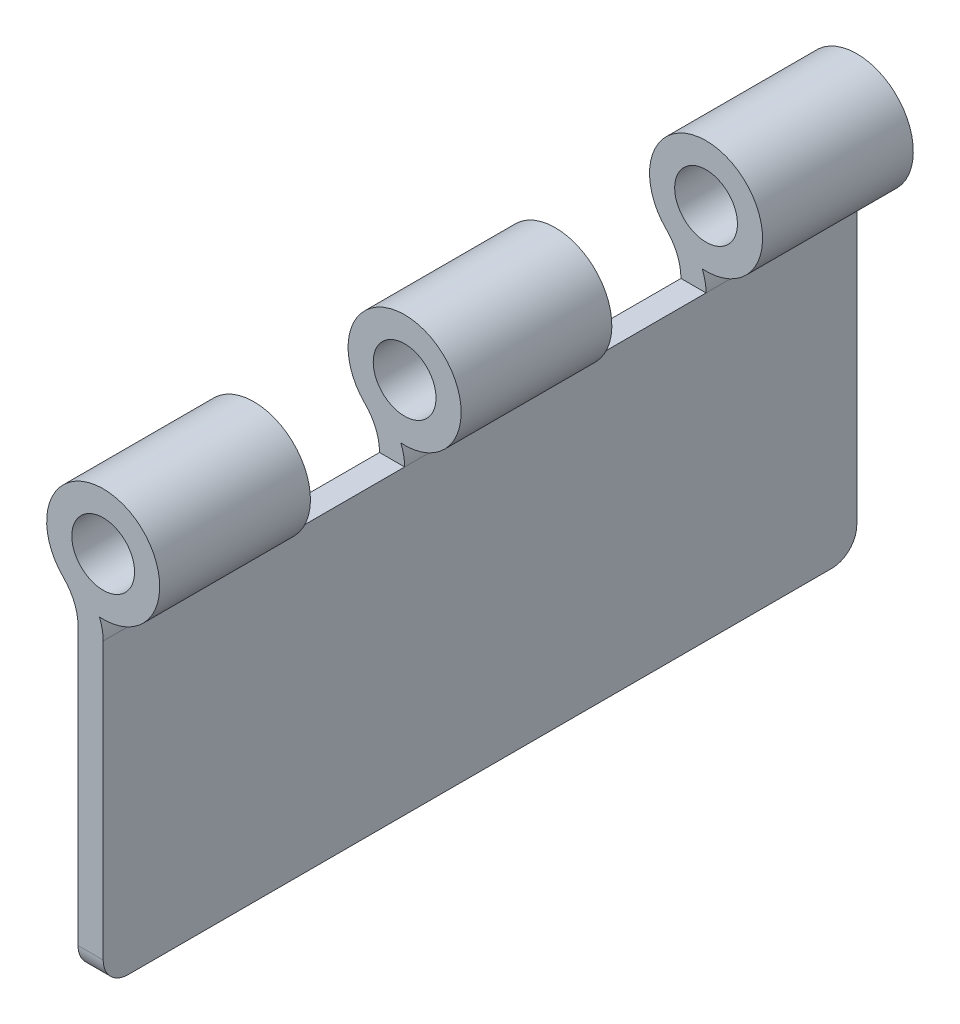
from build123d import *

# Parameters (mm, degrees)
SKETCH1_R           = 3.175
BOSS_EXTRUDE1_DEPTH = 38.1
SKETCH2_R           = 3.175
CUT_EXTRUDE1_DEPTH  = 7.62
FILLET1_R           = 2.54


with BuildPart() as part:
    # Sketch1 → Boss-Extrude1 (new, symmetric)
    with BuildSketch(Plane.XY):
        with BuildLine():
            Line((-2.54, 0), (0, 0))
            Line((0, 0), (0, 30.48))
            ThreePointArc((0, 30.48), (-0.096177955, 31.457600747), (-0.381023909, 32.39771574))
            ThreePointArc((-0.381023909, 32.39771574), (2.351034724, 43.309017251), (-4.024171598, 34.042011834))
            ThreePointArc((-4.024171598, 34.042011834), (-2.925884615, 32.409423077), (-2.54, 30.48))
            Line((-2.54, 30.48), (-2.54, 0))
        make_face()
        with Locations((0, 38.1)):
            Circle(SKETCH1_R, mode=Mode.SUBTRACT)
    extrude(amount=BOSS_EXTRUDE1_DEPTH, both=True)

    # Sketch2 → Cut-Extrude1 (cut, symmetric)
    with BuildSketch(Plane.XY.offset(15.24)):
        with BuildLine():
            Line((-2.54, 30.48), (0, 30.48))
            ThreePointArc((0, 30.48), (-0.096177955, 31.457600747), (-0.381023909, 32.39771574))
            ThreePointArc((-0.381023909, 32.39771574), (2.351034724, 43.309017251), (-4.024171598, 34.042011834))
            ThreePointArc((-4.024171598, 34.042011834), (-2.925884615, 32.409423077), (-2.54, 30.48))
        make_face()
        with Locations((0, 38.1)):
            Circle(SKETCH2_R, mode=Mode.SUBTRACT)
    cut_extrude1 = extrude(amount=CUT_EXTRUDE1_DEPTH, both=True, mode=Mode.SUBTRACT)

    # Mirror1: Cut-Extrude1 across plane
    add(cut_extrude1.mirror(Plane.XY), mode=Mode.SUBTRACT)

    # Fillet1
    fillet1_edges = [part.edges().sort_by_distance(p)[0] for p in [
        (-1.27, 0, -38.1),
        (-1.27, 0, 38.1),
    ]]
    fillet(fillet1_edges, radius=FILLET1_R)


solid = part.part
